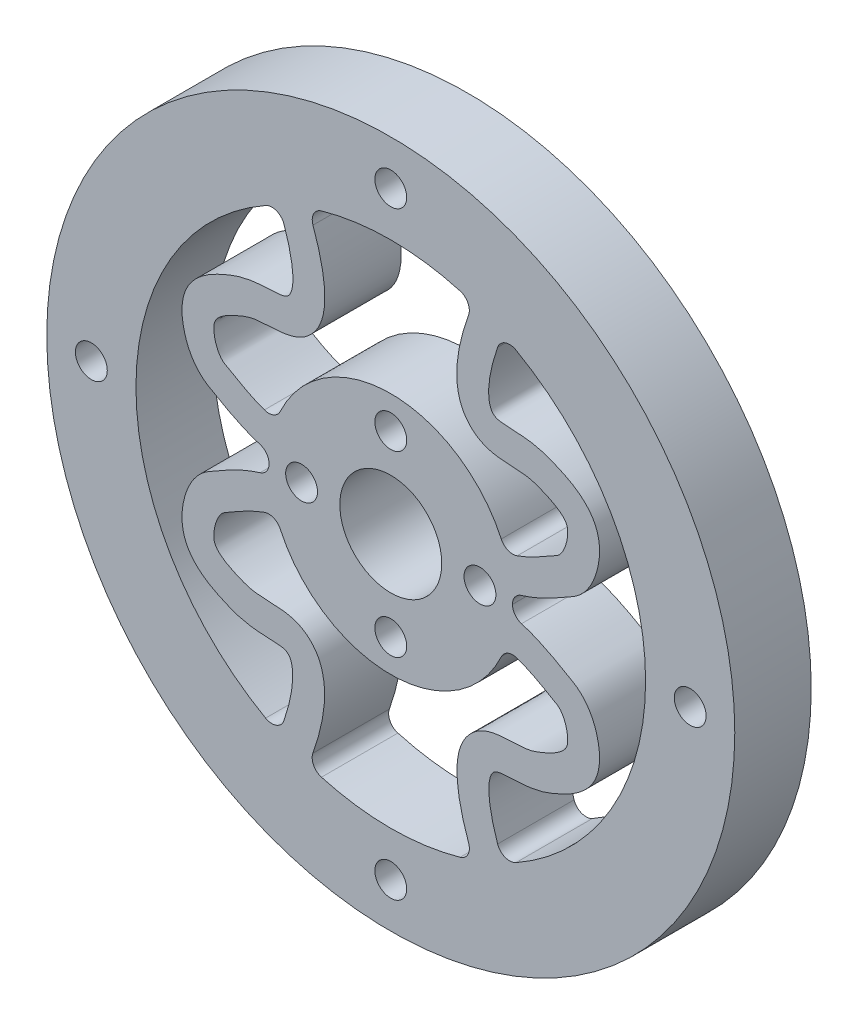
from build123d import *

# Parameters (mm, degrees)
SKETCH1_R           = 27
SKETCH1_R_2         = 1.25
SKETCH1_R_3         = 4
BOSS_EXTRUDE1_DEPTH = 6
FILLET1_R           = 1


with BuildPart() as part:
    # Sketch1 → Boss-Extrude1 (new body)
    with BuildSketch(Plane.XY):
        Circle(SKETCH1_R)
        with BuildLine():
            ThreePointArc((-8.793542616, -17.963118), (-19.999999999, 0.000195013), (-8.793192309, 17.963289482))
            add(Edge.make_bspline(
                [(-8.793192309, 17.963289482), (-8.791819726, 17.959955159), (-8.750530038, 17.859582001), (-8.658606637, 17.631192425), (-8.441988202, 17.062865207), (-8.149752674, 16.204886503), (-7.846651109, 15.063511063), (-7.669193713, 13.941774811), (-7.675704027, 12.977870593), (-7.871530224, 12.356347516), (-8.096380937, 12.116702287), (-8.437103889, 11.9458351), (-9.265810437, 11.877704827), (-10.068991377, 11.844133649), (-10.982838231, 11.771672235), (-12.031992183, 11.537287231), (-12.892843007, 11.191360085), (-14.045609317, 10.676049064), (-15.224994553, 9.925211979), (-16.127399692, 8.663278744), (-16.433161448, 7.419159214), (-16.360931492, 6.266689323), (-16.068311748, 5.081083419), (-15.596118448, 4.134583027), (-15.105618425, 3.535815083), (-14.773789124, 3.227502485), (-14.487296104, 3.012495594), (-14.213296989, 2.847475541), (-13.83947459, 2.635276317), (-12.932227596, 2.101440752), (-11.383562712, 1.322529722), (-10.155313903, 0.901526617), (-9.52284367, 0.771221905), (-9.519943612, 0.770626238)],
                knots=[0.003711731, 0.003711731, 0.003711731, 0.003711731, 0.00463509, 0.03125, 0.0625, 0.125, 0.1875, 0.25, 0.3125, 0.375, 0.4375, 0.5, 0.53125, 0.5625, 0.59375, 0.625, 0.65625, 0.6875, 0.75, 0.78125, 0.8125, 0.84375, 0.875, 0.90625, 0.921875, 0.9296875, 0.9375, 0.9453125, 0.953125, 0.96875, 0.984375, 0.999645143, 0.99971531, 0.99971531, 0.99971531, 0.99971531], degree=3))
            ThreePointArc((-9.519943612, 0.770626238), (-9.551083246, 0), (-9.519943612, -0.770626238))
            add(Edge.make_bspline(
                [(-8.793192309, -17.963289482), (-8.789991378, -17.955440372), (-8.756737686, -17.873751558), (-8.674911229, -17.668674641), (-8.473409672, -17.139044033), (-8.181809902, -16.282007173), (-7.873641422, -15.126715202), (-7.688280288, -13.981403295), (-7.686855821, -12.98900892), (-7.882260069, -12.340628045), (-8.105400043, -12.101968082), (-8.427122777, -11.936464261), (-9.255727768, -11.873918304), (-10.061835477, -11.847063974), (-10.980376768, -11.781232825), (-12.037716922, -11.549062536), (-12.90125468, -11.200632458), (-14.054210087, -10.681787008), (-15.231208358, -9.925388973), (-16.128981056, -8.662418423), (-16.433844664, -7.420482385), (-16.36196419, -6.26742892), (-16.069068975, -5.081830915), (-15.596930434, -4.135408065), (-15.106681345, -3.536715559), (-14.77502843, -3.228407876), (-14.488707037, -3.013395724), (-14.214677424, -2.848271378), (-13.840675777, -2.635930508), (-12.932965257, -2.101886501), (-11.383610699, -1.322716374), (-10.155279837, -0.901583978), (-9.522846478, -0.771222774), (-9.519943612, -0.770626238)],
                knots=[0.008786599, 0.008786599, 0.008786599, 0.008786599, 0.01097773, 0.03125, 0.0625, 0.125, 0.1875, 0.25, 0.3125, 0.375, 0.4375, 0.5, 0.53125, 0.5625, 0.59375, 0.625, 0.65625, 0.6875, 0.75, 0.78125, 0.8125, 0.84375, 0.875, 0.90625, 0.921875, 0.9296875, 0.9375, 0.9453125, 0.953125, 0.96875, 0.984375, 0.999644738, 0.999714818, 0.999714818, 0.999714818, 0.999714818], degree=3))
            ThreePointArc((-8.793192309, -17.963289482), (-8.793367463, -17.963203742), (-8.793542616, -17.963118))
        make_face(mode=Mode.SUBTRACT)
        with Locations((0, -23.5)):
            Circle(SKETCH1_R_2, mode=Mode.SUBTRACT)
        with BuildLine():
            ThreePointArc((6.481919156, -18.920484245), (0, -20), (-6.481919156, -18.920484245))
            add(Edge.make_bspline(
                [(-6.481919156, -18.920484245), (-6.478735855, -18.912690153), (-6.439646563, -18.816831454), (-6.345794117, -18.581887105), (-6.11729687, -17.98102125), (-5.788216521, -17.014379651), (-5.428267867, -15.669030667), (-5.19060991, -14.230635227), (-5.174421161, -12.762331628), (-5.523626246, -11.283839025), (-6.409102584, -10.167665685), (-7.453586988, -9.625914227), (-8.349523119, -9.426377603), (-9.169806008, -9.377547863), (-9.947179125, -9.351749564), (-10.674749906, -9.289746564), (-11.236737561, -9.170443424), (-11.931601827, -8.897851129), (-12.637308829, -8.578454905), (-13.211494896, -8.235096972), (-13.612860814, -7.884018736), (-13.812820828, -7.571677323), (-13.896634499, -7.283557006), (-13.879427461, -6.643334726), (-13.730369379, -6.061661259), (-13.551785512, -5.654964518), (-13.396768185, -5.398507494), (-13.265370966, -5.240398305), (-13.160728209, -5.145230677), (-13.102026522, -5.100115548), (-12.979767639, -5.023691833), (-12.578146914, -4.79501475), (-11.72496529, -4.293216784), (-10.601363951, -3.731875287), (-9.652861933, -3.378370349), (-9.219889108, -3.261172671), (-8.993443949, -3.215766953)],
                knots=[0.007767034, 0.007767034, 0.007767034, 0.007767034, 0.009702959, 0.03125, 0.0625, 0.125, 0.1875, 0.25, 0.3125, 0.375, 0.4375, 0.46875, 0.5, 0.53125, 0.5625, 0.59375, 0.625, 0.65625, 0.6875, 0.71875, 0.75, 0.78125, 0.8125, 0.84375, 0.875, 0.890625, 0.90625, 0.921875, 0.9296875, 0.9375, 0.9453125, 0.953125, 0.96875, 0.984375, 0.9921875, 0.999999773, 0.999999773, 0.999999773, 0.999999773], degree=3))
            ThreePointArc((-8.993443949, -3.215766953), (0, -9.551083246), (8.993443949, -3.215766953))
            add(Edge.make_bspline(
                [(6.481919156, -18.920484245), (6.478735855, -18.912690153), (6.439646563, -18.816831454), (6.345794117, -18.581887105), (6.11729687, -17.98102125), (5.788216521, -17.014379651), (5.428267867, -15.669030667), (5.19060991, -14.230635227), (5.174421161, -12.762331628), (5.523626246, -11.283839025), (6.409102584, -10.167665685), (7.453586988, -9.625914227), (8.349523119, -9.426377603), (9.169806008, -9.377547863), (9.947179125, -9.351749564), (10.674749906, -9.289746564), (11.236737561, -9.170443424), (11.931601827, -8.897851129), (12.637308829, -8.578454905), (13.211494896, -8.235096972), (13.612860814, -7.884018736), (13.812820828, -7.571677323), (13.896634499, -7.283557006), (13.879427461, -6.643334726), (13.730369379, -6.061661259), (13.551785512, -5.654964518), (13.396768185, -5.398507494), (13.265370966, -5.240398305), (13.160728209, -5.145230677), (13.102026522, -5.100115548), (12.979767639, -5.023691833), (12.578146914, -4.79501475), (11.72496529, -4.293216784), (10.601363951, -3.731875287), (9.652861933, -3.378370349), (9.219889108, -3.261172671), (8.993443949, -3.215766953)],
                knots=[0.007767034, 0.007767034, 0.007767034, 0.007767034, 0.009702959, 0.03125, 0.0625, 0.125, 0.1875, 0.25, 0.3125, 0.375, 0.4375, 0.46875, 0.5, 0.53125, 0.5625, 0.59375, 0.625, 0.65625, 0.6875, 0.71875, 0.75, 0.78125, 0.8125, 0.84375, 0.875, 0.890625, 0.90625, 0.921875, 0.9296875, 0.9375, 0.9453125, 0.953125, 0.96875, 0.984375, 0.9921875, 0.999999773, 0.999999773, 0.999999773, 0.999999773], degree=3))
        make_face(mode=Mode.SUBTRACT)
        with Locations((0, -7)):
            Circle(SKETCH1_R_2, mode=Mode.SUBTRACT)
        with Locations((-23.5, 0)):
            Circle(SKETCH1_R_2, mode=Mode.SUBTRACT)
        with Locations((-7, 0)):
            Circle(SKETCH1_R_2, mode=Mode.SUBTRACT)
        with BuildLine():
            ThreePointArc((-6.481919156, 18.920484245), (0, 20), (6.481919156, 18.920484245))
            add(Edge.make_bspline(
                [(6.481919156, 18.920484245), (6.4805517, 18.917163905), (6.433608759, 18.803109573), (6.329938615, 18.545630419), (6.086310935, 17.906261198), (5.755923222, 16.937012318), (5.399824837, 15.601004886), (5.169749773, 14.178312495), (5.163660438, 12.726800047), (5.528820656, 11.262813892), (6.421602201, 10.168843813), (7.45643818, 9.637387987), (8.34314382, 9.436345371), (9.159009732, 9.381281688), (9.934055418, 9.349032942), (10.661623884, 9.281952314), (11.229485398, 9.159041179), (11.927818361, 8.88576089), (12.635661845, 8.567602378), (13.211571147, 8.225953569), (13.613231571, 7.876957399), (13.811883134, 7.56790118), (13.895220813, 7.282977426), (13.878027104, 6.64165696), (13.729021691, 6.060305702), (13.550561287, 5.653862647), (13.395641903, 5.397635121), (13.264309072, 5.23966717), (13.15964672, 5.144535999), (13.100895712, 5.09940699), (12.978372895, 5.022867123), (12.576537058, 4.79413076), (11.72377396, 4.292535475), (10.600862046, 3.731540274), (9.652803454, 3.378274859), (9.219850747, 3.261137626), (8.993443949, 3.215766953)],
                knots=[0.003305948, 0.003305948, 0.003305948, 0.003305948, 0.004126624, 0.03125, 0.0625, 0.125, 0.1875, 0.25, 0.3125, 0.375, 0.4375, 0.46875, 0.5, 0.53125, 0.5625, 0.59375, 0.625, 0.65625, 0.6875, 0.71875, 0.75, 0.78125, 0.8125, 0.84375, 0.875, 0.890625, 0.90625, 0.921875, 0.9296875, 0.9375, 0.9453125, 0.953125, 0.96875, 0.984375, 0.9921875, 0.999999775, 0.999999775, 0.999999775, 0.999999775], degree=3))
            ThreePointArc((8.993443949, 3.215766953), (0, 9.551083246), (-8.993443949, 3.215766953))
            add(Edge.make_bspline(
                [(-6.481919156, 18.920484245), (-6.4805517, 18.917163905), (-6.433608759, 18.803109574), (-6.329938615, 18.545630419), (-6.086310935, 17.906261198), (-5.755923222, 16.937012318), (-5.399824837, 15.601004886), (-5.169749773, 14.178312495), (-5.163660438, 12.726800047), (-5.528820656, 11.262813892), (-6.421602201, 10.168843813), (-7.45643818, 9.637387987), (-8.34314382, 9.436345371), (-9.159009732, 9.381281688), (-9.934055418, 9.349032942), (-10.661623884, 9.281952314), (-11.229485398, 9.159041179), (-11.927818361, 8.88576089), (-12.635661845, 8.567602378), (-13.211571147, 8.225953569), (-13.613231571, 7.876957399), (-13.811883134, 7.56790118), (-13.895220813, 7.282977426), (-13.878027104, 6.64165696), (-13.729021691, 6.060305702), (-13.550561287, 5.653862648), (-13.395641903, 5.397635121), (-13.264309072, 5.23966717), (-13.15964672, 5.144535999), (-13.100895712, 5.09940699), (-12.978372895, 5.022867123), (-12.576537058, 4.79413076), (-11.72377396, 4.292535475), (-10.600862046, 3.731540274), (-9.652803454, 3.378274859), (-9.219850747, 3.261137626), (-8.993443949, 3.215766953)],
                knots=[0.003305948, 0.003305948, 0.003305948, 0.003305948, 0.004126624, 0.03125, 0.0625, 0.125, 0.1875, 0.25, 0.3125, 0.375, 0.4375, 0.46875, 0.5, 0.53125, 0.5625, 0.59375, 0.625, 0.65625, 0.6875, 0.71875, 0.75, 0.78125, 0.8125, 0.84375, 0.875, 0.890625, 0.90625, 0.921875, 0.9296875, 0.9375, 0.9453125, 0.953125, 0.96875, 0.984375, 0.9921875, 0.999999775, 0.999999775, 0.999999775, 0.999999775], degree=3))
        make_face(mode=Mode.SUBTRACT)
        Circle(SKETCH1_R_3, mode=Mode.SUBTRACT)
        with Locations((7, 0)):
            Circle(SKETCH1_R_2, mode=Mode.SUBTRACT)
        with Locations((0, 7)):
            Circle(SKETCH1_R_2, mode=Mode.SUBTRACT)
        with BuildLine():
            ThreePointArc((8.793192309, 17.963289482), (20, 0), (8.793192309, -17.963289482))
            add(Edge.make_bspline(
                [(8.793192309, -17.963289482), (8.789991378, -17.955440372), (8.756737686, -17.873751558), (8.674911229, -17.668674641), (8.473409672, -17.139044033), (8.181809902, -16.282007173), (7.873641422, -15.126715202), (7.688280288, -13.981403295), (7.686855821, -12.98900892), (7.882260069, -12.340628045), (8.105400043, -12.101968082), (8.427122777, -11.936464261), (9.255727768, -11.873918304), (10.061835477, -11.847063974), (10.980376768, -11.781232825), (12.037716922, -11.549062536), (12.90125468, -11.200632458), (14.054210087, -10.681787008), (15.231208358, -9.925388973), (16.128981056, -8.662418423), (16.433844664, -7.420482385), (16.36196419, -6.26742892), (16.069068975, -5.081830915), (15.596930434, -4.135408065), (15.106681345, -3.536715559), (14.77502843, -3.228407876), (14.488707037, -3.013395724), (14.214677424, -2.848271378), (13.840675777, -2.635930508), (12.932965257, -2.101886501), (11.383610699, -1.322716374), (10.155279837, -0.901583978), (9.522846478, -0.771222774), (9.519943612, -0.770626238)],
                knots=[0.008786599, 0.008786599, 0.008786599, 0.008786599, 0.01097773, 0.03125, 0.0625, 0.125, 0.1875, 0.25, 0.3125, 0.375, 0.4375, 0.5, 0.53125, 0.5625, 0.59375, 0.625, 0.65625, 0.6875, 0.75, 0.78125, 0.8125, 0.84375, 0.875, 0.90625, 0.921875, 0.9296875, 0.9375, 0.9453125, 0.953125, 0.96875, 0.984375, 0.999644738, 0.999714818, 0.999714818, 0.999714818, 0.999714818], degree=3))
            ThreePointArc((9.519943612, -0.770626238), (9.551083246, 0), (9.519943612, 0.770626238))
            add(Edge.make_bspline(
                [(8.793192309, 17.963289482), (8.791819726, 17.959955159), (8.750530038, 17.859582001), (8.658606637, 17.631192425), (8.441988202, 17.062865207), (8.149752674, 16.204886503), (7.846651109, 15.063511063), (7.669193713, 13.941774812), (7.675704027, 12.977870593), (7.871530224, 12.356347516), (8.096380937, 12.116702287), (8.437103889, 11.9458351), (9.265810437, 11.877704827), (10.068991377, 11.844133649), (10.982838231, 11.771672235), (12.031992183, 11.537287231), (12.892843007, 11.191360085), (14.045609317, 10.676049064), (15.224994553, 9.925211979), (16.127399692, 8.663278744), (16.433161448, 7.419159214), (16.360931492, 6.266689323), (16.068311748, 5.081083419), (15.596118448, 4.134583027), (15.105618425, 3.535815083), (14.773789124, 3.227502485), (14.487296104, 3.012495594), (14.213296989, 2.847475541), (13.83947459, 2.635276317), (12.932227596, 2.101440752), (11.383562712, 1.322529722), (10.155313903, 0.901526617), (9.52284367, 0.771221905), (9.519943612, 0.770626238)],
                knots=[0.003711731, 0.003711731, 0.003711731, 0.003711731, 0.00463509, 0.03125, 0.0625, 0.125, 0.1875, 0.25, 0.3125, 0.375, 0.4375, 0.5, 0.53125, 0.5625, 0.59375, 0.625, 0.65625, 0.6875, 0.75, 0.78125, 0.8125, 0.84375, 0.875, 0.90625, 0.921875, 0.9296875, 0.9375, 0.9453125, 0.953125, 0.96875, 0.984375, 0.999645143, 0.99971531, 0.99971531, 0.99971531, 0.99971531], degree=3))
        make_face(mode=Mode.SUBTRACT)
        with Locations((23.5, 0)):
            Circle(SKETCH1_R_2, mode=Mode.SUBTRACT)
        with Locations((0, 23.5)):
            Circle(SKETCH1_R_2, mode=Mode.SUBTRACT)
    extrude(amount=BOSS_EXTRUDE1_DEPTH)

    # Fillet1
    fillet1_edges = [part.edges().sort_by_distance(p)[0] for p in [
        (-8.993443949, 3.215766953, 3),
        (9.519943612, -0.770626238, 3),
        (8.993443949, -3.215766953, 3),
        (-8.993443949, -3.215766953, 3),
        (-9.519943612, 0.770626238, 3),
        (-9.519943612, -0.770626238, 3),
        (6.481919156, -18.920484245, 3),
        (-8.793192309, -17.963289482, 3),
        (8.793192309, -17.963289482, 3),
        (-6.481919156, -18.920484245, 3),
        (-6.481919156, 18.920484245, 3),
        (-8.793192309, 17.963289482, 3),
        (9.519943612, 0.770626238, 3),
        (8.993443949, 3.215766953, 3),
        (8.793192309, 17.963289482, 3),
        (6.481919156, 18.920484245, 3),
    ]]
    fillet(fillet1_edges, radius=FILLET1_R)


solid = part.part
